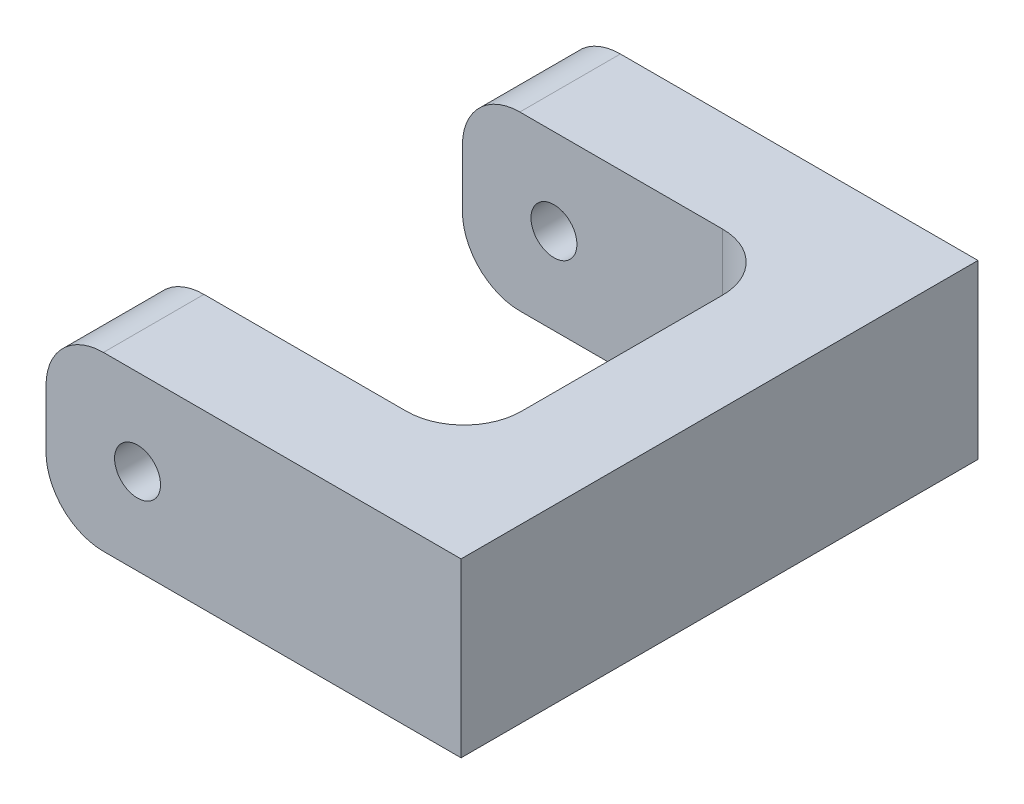
from build123d import *

# Parameters (mm, degrees)
EXTRUDE_START       = 19
EXTRUDE_1_DEPTH     = 90
SKETCH_3_W          = 57.418796995
SKETCH_3_H          = 55
CUT_EXTRUDE_1_DEPTH = 43.5
SKETCH_4_R          = 4
CUT_EXTRUDE_2_DEPTH = 100
FILLET_1_R          = 10


with BuildPart() as part:
    # Эскиз1 → Вытянуть1 (new body)
    with BuildSketch(Plane.XY.offset(EXTRUDE_START)):
        with BuildLine():
            Line((-0.114856082, -4.041900761), (-0.114856082, -14.041900761))
            ThreePointArc((-0.114856082, -14.041900761), (2.814076106, -21.112968573), (9.885143918, -24.041900761))
            Line((9.885143918, -24.041900761), (72.152697535, -24.041900761))
            Line((72.152697535, -24.041900761), (72.152697535, 5.958099239))
            Line((72.152697535, 5.958099239), (9.885143918, 5.958099239))
            ThreePointArc((9.885143918, 5.958099239), (2.814076106, 3.02916705), (-0.114856082, -4.041900761))
        make_face()
    extrude(amount=-EXTRUDE_1_DEPTH)

    # Эскиз3 → Вырез-Вытянуть1 (cut, symmetric)
    with BuildSketch(Plane(origin=(0, 0, 0), x_dir=(1, 0, 0), z_dir=(0, 1, 0))):
        with Locations((26.443299038, 26)):
            Rectangle(SKETCH_3_W, SKETCH_3_H)
    extrude(amount=CUT_EXTRUDE_1_DEPTH, both=True, mode=Mode.SUBTRACT)

    # Эскиз4 → Вырез-Вытянуть2 (cut, symmetric)
    with BuildSketch(Plane.XY):
        with Locations((15.823953055, -9.041900761)):
            Circle(SKETCH_4_R)
    extrude(amount=CUT_EXTRUDE_2_DEPTH, both=True, mode=Mode.SUBTRACT)

    # Скругление1
    fillet_1_edges = [part.edges().sort_by_distance(p)[0] for p in [
        (55.152697535, -9.041900761, 1.5),
        (55.152697535, -9.041900761, -53.5),
    ]]
    fillet(fillet_1_edges, radius=FILLET_1_R)


solid = part.part
